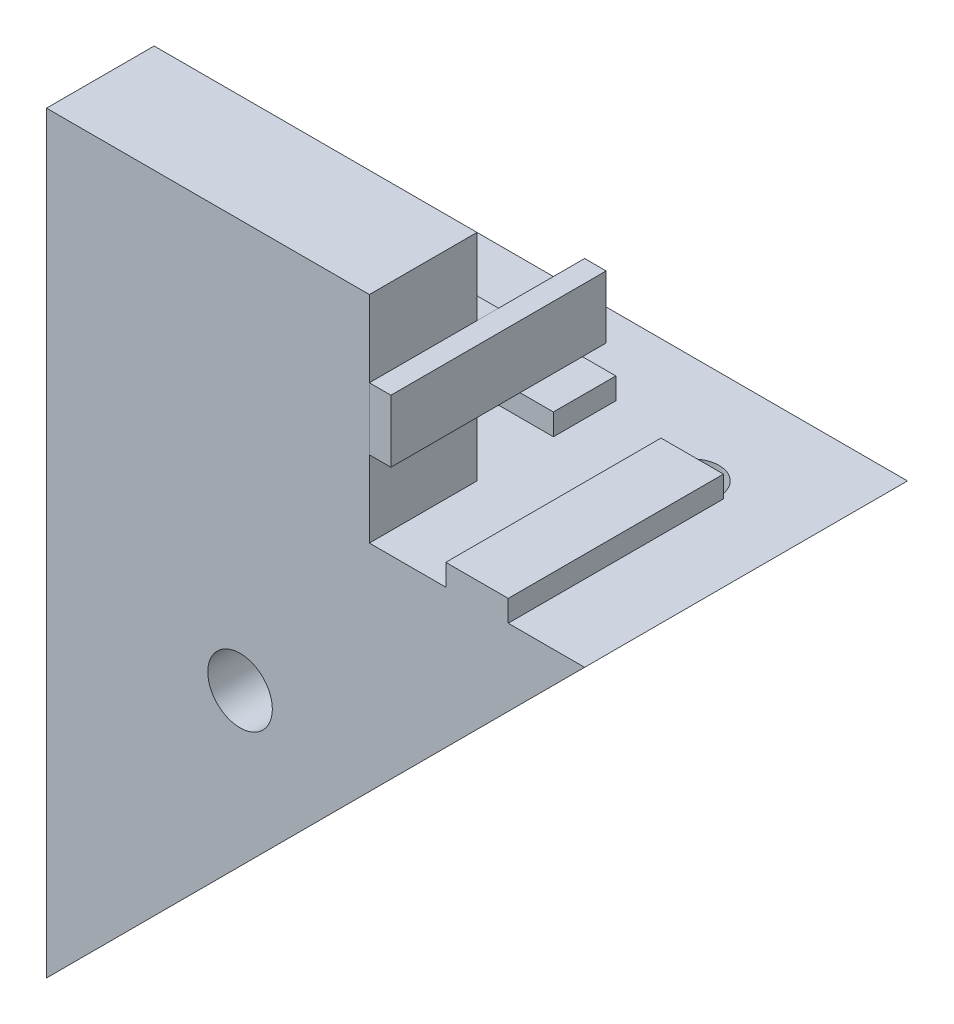
from build123d import *

# Parameters (mm, degrees)
MAIN_DEPTH          = 15
SKETCH4_W           = 15
SKETCH4_H           = 10
CUT_EXTRUDE2_DEPTH  = 10
SKETCH2_W           = 15
SKETCH2_H           = 2.9
BOSS_EXTRUDE3_DEPTH = 1
SKETCH5_W           = 2.9
SKETCH5_H           = 12.715728752
BOSS_EXTRUDE4_DEPTH = 1
SKETCH6_R           = 1.5
BOSS_EXTRUDE5_DEPTH = 5
BOSS_EXTRUDE6_DEPTH = 1
SKETCH8_W           = 2.9
SKETCH8_H           = 10
BOSS_EXTRUDE7_DEPTH = 1
SKETCH9_W           = 1
SKETCH9_H           = 2.9
BOSS_EXTRUDE8_DEPTH = 10
SKETCH11_R          = 1.25
CUT_EXTRUDE4_DEPTH  = 39.405728739
SKETCH12_R          = 1.5
CUT_EXTRUDE5_DEPTH  = 39.405728739
SKETCH13_W          = 15
SKETCH13_H          = 2.9
BOSS_EXTRUDE9_DEPTH = 1


with BuildPart() as part:
    # Sketch1 → Main (new body)
    with BuildSketch(Plane.XY):
        Polygon((0, 0), (-10, 0), (-10, 10), (-25, 10), (-25, -10.857864376), (-16.008621971, -1.866486348), (-8.937554159, -8.937554159), align=None)
    extrude(amount=MAIN_DEPTH)

    # Sketch4 → Cut-Extrude2 (cut)
    with BuildSketch(Plane(origin=(0, 0, 0), x_dir=(-1, 0, 0), z_dir=(0, 0, -1))):
        with Locations((17.5, 5)):
            Rectangle(SKETCH4_W, SKETCH4_H)
    extrude(amount=-CUT_EXTRUDE2_DEPTH, mode=Mode.SUBTRACT)

    # Sketch2 → Boss-Extrude3 (add)
    with BuildSketch(Plane(origin=(0, 0, 10), x_dir=(-1, 0, 0), z_dir=(0, 0, -1))):
        with Locations((17.5, 5)):
            Rectangle(SKETCH2_W, SKETCH2_H)
    extrude(amount=BOSS_EXTRUDE3_DEPTH)

    # Sketch5 → Boss-Extrude4 (add)
    with BuildSketch(Plane(origin=(-7.071067812, 7.071067812, 0), x_dir=(0, 0, -1), z_dir=(0.7071067811865573, -0.7071067811865378, 0))):
        with Locations((-5, -18.997474683)):
            Rectangle(SKETCH5_W, SKETCH5_H)
    extrude(amount=BOSS_EXTRUDE4_DEPTH)

    # Sketch6 → Boss-Extrude5 (add)
    with BuildSketch(Plane.XY.offset(10)):
        Polygon((-25, -10.857864376), (-16.008621971, -1.866486348), (-8.937554159, -8.937554159), (-25, -25), align=None)
        with Locations((-16.008621971, -8.937554159)):
            Circle(SKETCH6_R, mode=Mode.SUBTRACT)
    extrude(amount=BOSS_EXTRUDE5_DEPTH)

    # Sketch7 → Boss-Extrude6 (add)
    with BuildSketch(Plane(origin=(0, 0, 10), x_dir=(-1, 0, 0), z_dir=(0, 0, -1))):
        Polygon((13.498392898, -4.376715421), (25, -15.878322523), (25, -19.979541854), (11.447783233, -6.427325086), align=None)
    extrude(amount=BOSS_EXTRUDE6_DEPTH)

    # Sketch8 → Boss-Extrude7 (add)
    with BuildSketch(Plane(origin=(0, 0, 0), x_dir=(1, 0, 0), z_dir=(0, 1, 0))):
        with Locations((-5, -10)):
            Rectangle(SKETCH8_W, SKETCH8_H)
    extrude(amount=BOSS_EXTRUDE7_DEPTH)

    # Sketch11 → Cut-Extrude4 (cut, through all)
    with BuildSketch(Plane(origin=(0, 0, 0), x_dir=(1, 0, 0), z_dir=(0, 1, 0))):
        with Locations((-5, -5)):
            Circle(SKETCH11_R)
    extrude(amount=-CUT_EXTRUDE4_DEPTH, mode=Mode.SUBTRACT)

    # Sketch12 → Cut-Extrude5 (cut, through all)
    with BuildSketch(Plane.XY.offset(15)):
        with Locations((-16.008621971, -8.937554159)):
            Circle(SKETCH12_R)
    extrude(amount=-CUT_EXTRUDE5_DEPTH, mode=Mode.SUBTRACT)

    # Sketch13 → Boss-Extrude9 (add)
    with BuildSketch(Plane(origin=(0, 0, 0), x_dir=(1, 0, 0), z_dir=(0, 1, 0))):
        with Locations((-17.5, -5)):
            Rectangle(SKETCH13_W, SKETCH13_H)
    extrude(amount=BOSS_EXTRUDE9_DEPTH)


with BuildPart() as body_2:
    # Sketch9 → Boss-Extrude8 (new body)
    with BuildSketch(Plane.XY.offset(15)):
        with Locations((-9.5, 5)):
            Rectangle(SKETCH9_W, SKETCH9_H)
    extrude(amount=-BOSS_EXTRUDE8_DEPTH)


solid = Compound([part.part, body_2.part])
